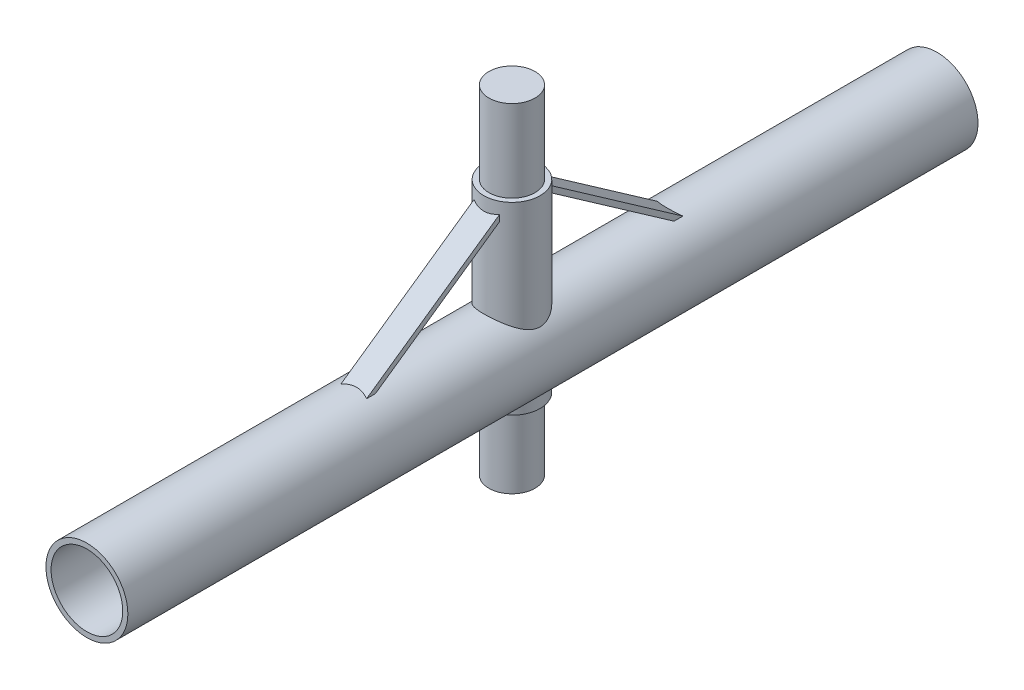
from build123d import *

# Parameters (mm, degrees)
SKETCH1_R                = 60
SKETCH1_R_2              = 52.5
EXTRUDE_THIN1_DEPTH      = 622.5
EXTRUDE_THIN2_DEPTH      = 210
EXTRUDE_THIN2_DEPTH_BACK = 60
SKETCH2_R                = 41.25
SKETCH2_R_2              = 33.75
BOSS_EXTRUDE1_DEPTH      = 120
BOSS_EXTRUDE1_DEPTH_BACK = 375
SKETCH3_R                = 33.75
EXTRUDE_THIN3_DEPTH      = 18.75
SKETCH5_R                = 52.5
CUT_EXTRUDE1_DEPTH       = 1290.389390472


with BuildPart() as part:
    # Sketch1 → Extrude-Thin1 (new, symmetric)
    with BuildSketch(Plane.XY):
        Circle(SKETCH1_R)
        Circle(SKETCH1_R_2, mode=Mode.SUBTRACT)
    extrude(amount=EXTRUDE_THIN1_DEPTH, both=True)

    # Sketch2 → Extrude-Thin2 (add, two sides: drawn at the far end of the back side and taken through both)
    with BuildSketch(Plane(origin=(0, 0, 0), x_dir=(1, 0, 0), z_dir=(0, 1, 0)).offset(-EXTRUDE_THIN2_DEPTH_BACK)):
        Circle(SKETCH2_R)
        Circle(SKETCH2_R_2, mode=Mode.SUBTRACT)
    extrude(amount=EXTRUDE_THIN2_DEPTH + EXTRUDE_THIN2_DEPTH_BACK)

    # Sketch3 → Boss-Extrude1 (add, two sides: drawn at the far end of the back side and taken through both)
    with BuildSketch(Plane(origin=(0, 210, 0), x_dir=(1, 0, 0), z_dir=(0, 1, 0)).offset(-BOSS_EXTRUDE1_DEPTH_BACK)):
        with Locations(Location((0, 0, 0), (0, 0, 270))):
            Circle(SKETCH3_R)
    extrude(amount=BOSS_EXTRUDE1_DEPTH + BOSS_EXTRUDE1_DEPTH_BACK)


with BuildPart() as body_2:
    # Sketch4 → Extrude-Thin3 (new, symmetric)
    with BuildSketch(Plane(origin=(0, 0, 0), x_dir=(0, 0, -1), z_dir=(1, 0, 0))):
        Polygon((0, 210), (-300, 0), (-304.300967583, 6.144239404), (-4.300967583, 216.144239404), align=None)
    extrude_thin3 = extrude(amount=EXTRUDE_THIN3_DEPTH, both=True)


with BuildPart() as part_1:
    add(part.part)

    # Mirror2: Extrude-Thin3 across plane
    add(extrude_thin3.mirror(Plane.XY))


with BuildPart() as cut_extrude1_tool:
    # Sketch5 → Cut-Extrude1 (new, through all)
    with BuildSketch(Plane(origin=(0, 0, -622.5), x_dir=(-1, 0, 0), z_dir=(0, 0, -1))):
        Circle(SKETCH5_R)
    extrude(amount=-CUT_EXTRUDE1_DEPTH)


with BuildPart() as part_2:
    add(part_1.part)

    # Cut-Extrude1: cut by cut_extrude1_tool
    add(cut_extrude1_tool.part, mode=Mode.SUBTRACT)


with BuildPart() as body_2_1:
    add(body_2.part)

    # Cut-Extrude1: cut by cut_extrude1_tool
    add(cut_extrude1_tool.part, mode=Mode.SUBTRACT)


solid = Compound([part_2.part, body_2_1.part])
